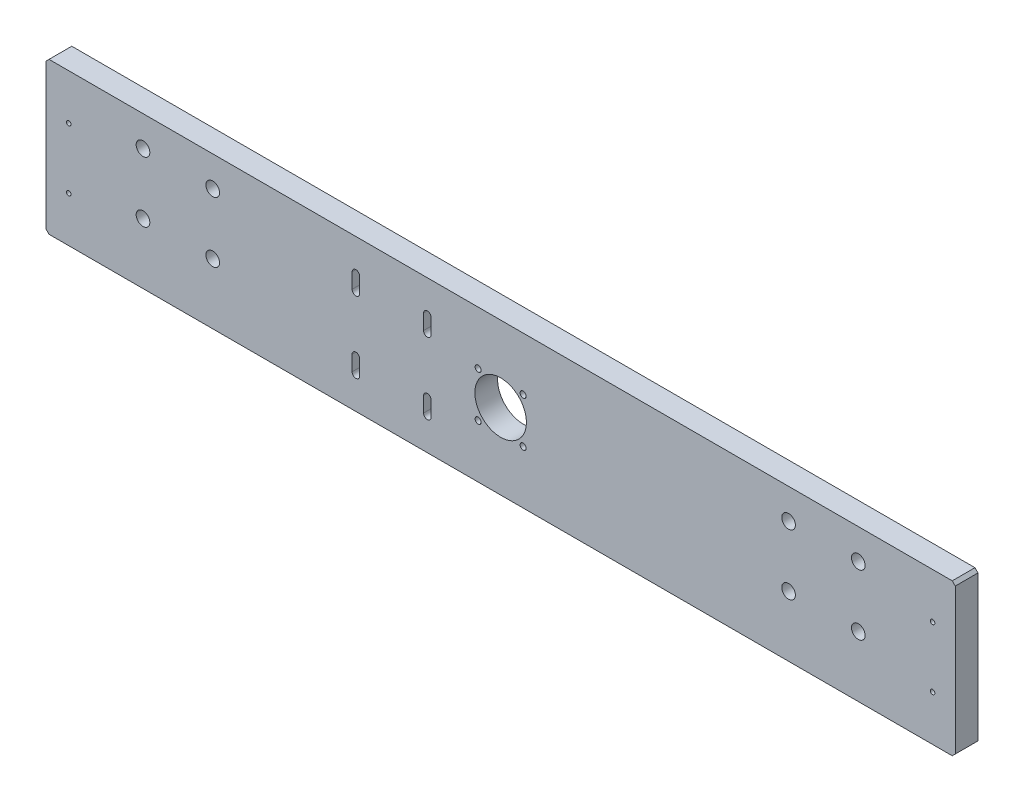
from build123d import *

# Parameters (mm, degrees)
SCHIZZO1_R            = 17
SCHIZZO1_R_2          = 2
SCHIZZO1_R_3          = 4.5
SCHIZZO1_R_4          = 1.5
BOSS_EXTRUDE1_DEPTH   = 15
M8_TAPPED_HOLE1_D     = 6.8
M8_TAPPED_HOLE1_DEPTH = 23.75
M8_TAPPED_HOLE1_TIP   = 2.042926105
CUT_EXTRUDE1_DEPTH    = 609.461173782


with BuildPart() as part:
    # Schizzo1 → Boss-Extrude1 (new body)
    with BuildSketch(Plane.XY):
        Polygon((2, 0), (598, 0), (600, 2), (600, 98), (598, 100), (2, 100), (0, 98), (0, 2), align=None)
        with Locations((300, 50)):
            Circle(SCHIZZO1_R, mode=Mode.SUBTRACT)
        with Locations((314.849242405, 64.849242405)):
            Circle(SCHIZZO1_R_2, mode=Mode.SUBTRACT)
        with Locations((314.849242405, 35.150757595)):
            Circle(SCHIZZO1_R_2, mode=Mode.SUBTRACT)
        with Locations((285.150757595, 35.150757595)):
            Circle(SCHIZZO1_R_2, mode=Mode.SUBTRACT)
        with Locations((536, 40)):
            Circle(SCHIZZO1_R_3, mode=Mode.SUBTRACT)
        with Locations((536, 80)):
            Circle(SCHIZZO1_R_3, mode=Mode.SUBTRACT)
        with Locations((490, 40)):
            Circle(SCHIZZO1_R_3, mode=Mode.SUBTRACT)
        with Locations((490, 80)):
            Circle(SCHIZZO1_R_3, mode=Mode.SUBTRACT)
        with Locations((585, 70)):
            Circle(SCHIZZO1_R_4, mode=Mode.SUBTRACT)
        with Locations((585, 30)):
            Circle(SCHIZZO1_R_4, mode=Mode.SUBTRACT)
        with Locations((15, 30)):
            Circle(SCHIZZO1_R_4, mode=Mode.SUBTRACT)
        with Locations((285.150757595, 64.849242405)):
            Circle(SCHIZZO1_R_2, mode=Mode.SUBTRACT)
        with Locations((15, 70)):
            Circle(SCHIZZO1_R_4, mode=Mode.SUBTRACT)
        with Locations((110, 80)):
            Circle(SCHIZZO1_R_3, mode=Mode.SUBTRACT)
        with Locations((110, 40)):
            Circle(SCHIZZO1_R_3, mode=Mode.SUBTRACT)
        with Locations((64, 80)):
            Circle(SCHIZZO1_R_3, mode=Mode.SUBTRACT)
        with Locations((64, 40)):
            Circle(SCHIZZO1_R_3, mode=Mode.SUBTRACT)
    extrude(amount=-BOSS_EXTRUDE1_DEPTH)

    # M8 Tapped Hole1
    with Locations(Plane(origin=(30, 0, -7.5), x_dir=(0, 0, -1), z_dir=(0, -1, 0))):
        with Locations((0, 0), (0, 540)):
            Hole(M8_TAPPED_HOLE1_D / 2, depth=M8_TAPPED_HOLE1_DEPTH)
            with Locations((0, 0, -(M8_TAPPED_HOLE1_DEPTH + M8_TAPPED_HOLE1_TIP / 2))):  # 118° drill point
                Cone(0, M8_TAPPED_HOLE1_D / 2, M8_TAPPED_HOLE1_TIP, mode=Mode.SUBTRACT)

    # Sketch4 → Cut-Extrude1 (cut, through all)
    with BuildSketch(Plane(origin=(0, 0, -15), x_dir=(-1, 0, 0), z_dir=(0, 0, -1))):
        with BuildLine():
            Line((-254.135394715, 68.57), (-254.135394715, 78.57))
            ThreePointArc((-254.135394715, 78.57), (-251.635394715, 81.07), (-249.135394715, 78.57))
            Line((-249.135394715, 78.57), (-249.135394715, 68.57))
            ThreePointArc((-249.135394715, 68.57), (-251.635394715, 66.07), (-254.135394715, 68.57))
        make_face()
        with BuildLine():
            Line((-206.995394715, 68.57), (-206.995394715, 78.57))
            ThreePointArc((-206.995394715, 78.57), (-204.495394715, 81.07), (-201.995394715, 78.57))
            Line((-201.995394715, 78.57), (-201.995394715, 68.57))
            ThreePointArc((-201.995394715, 68.57), (-204.495394715, 66.07), (-206.995394715, 68.57))
        make_face()
        with BuildLine():
            Line((-254.135394715, 21.43), (-254.135394715, 31.43))
            ThreePointArc((-254.135394715, 31.43), (-251.635394715, 33.93), (-249.135394715, 31.43))
            Line((-249.135394715, 31.43), (-249.135394715, 21.43))
            ThreePointArc((-249.135394715, 21.43), (-251.635394715, 18.93), (-254.135394715, 21.43))
        make_face()
        with BuildLine():
            Line((-206.995394715, 21.43), (-206.995394715, 31.43))
            ThreePointArc((-206.995394715, 31.43), (-204.495394715, 33.93), (-201.995394715, 31.43))
            Line((-201.995394715, 31.43), (-201.995394715, 21.43))
            ThreePointArc((-201.995394715, 21.43), (-204.495394715, 18.93), (-206.995394715, 21.43))
        make_face()
    extrude(amount=-CUT_EXTRUDE1_DEPTH, mode=Mode.SUBTRACT)


solid = part.part
